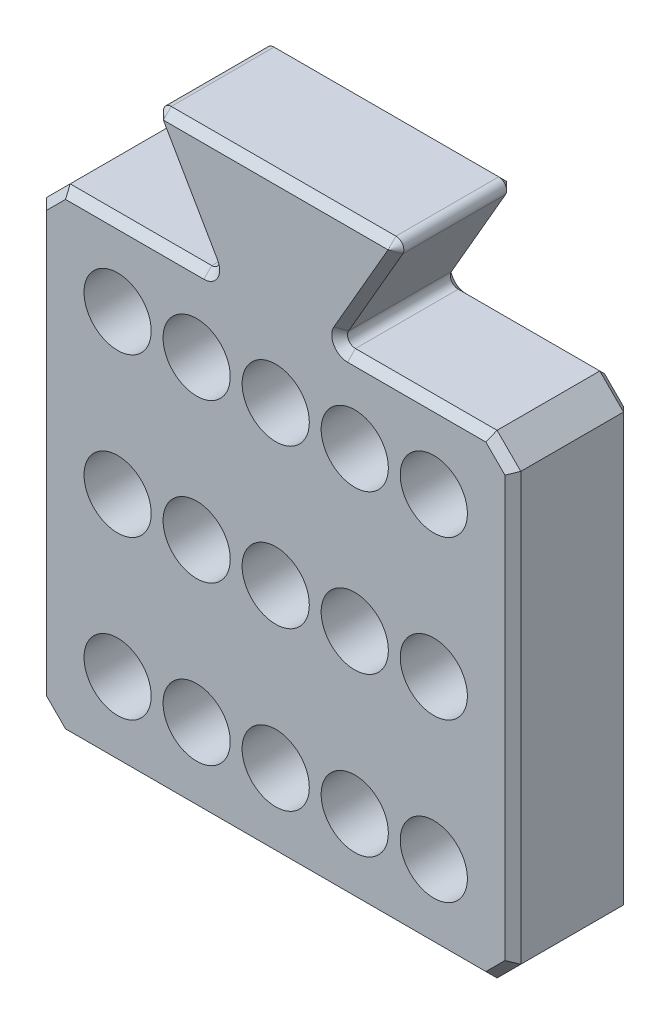
from build123d import *

# Parameters (mm, degrees)
SKETCH2_W                  = 60
SKETCH2_H                  = 60
BOSS_EXTRUDE1_DEPTH        = 7.5
BOSS_EXTRUDE2_DEPTH        = 15
FILLET1_R                  = 1
SKETCH4_R                  = 2.5
CUT_EXTRUDE1_DEPTH         = 57.024687639
CUT_EXTRUDE2_START         = -7.5
SKETCH5_R                  = 4.25
CUT_EXTRUDE2_DEPTH         = 7.5
CHAMFER3_SIZE              = 1
LPATTERN1_COUNT            = 5
LPATTERN1_PITCH            = 10
CHAMFER3_OF_LPATTERN1_SIZE = 1
CHAMFER1_SIZE              = 3
CHAMFER2_SIZE              = 1


# Read off the part's stored shape, not the designer's step: LPattern2
with BuildPart() as part:
    # Sketch2 → Boss-Extrude1 (new, symmetric)
    with BuildSketch(Plane(origin=(0, 0, 0), x_dir=(0, 1, 0), z_dir=(0, 0, 1))):
        Rectangle(SKETCH2_W, SKETCH2_H)
    extrude(amount=BOSS_EXTRUDE1_DEPTH, both=True)

    # Sketch3 → Boss-Extrude2 (add, through all)
    with BuildSketch(Plane.XY.offset(7.5)):
        Polygon((-15.943747687, 44.875), (-7.355662433, 30), (7.355662433, 30), (15.943747687, 44.875), align=None)
    extrude(amount=-BOSS_EXTRUDE2_DEPTH)

    # Fillet1
    fillet1_edges = [part.edges().sort_by_distance(p)[0] for p in [
        (-7.355662433, 30, 0),
        (-15.943747687, 44.875, 0),
        (15.943747687, 44.875, 0),
        (7.355662433, 30, 0),
    ]]
    fillet(fillet1_edges, radius=FILLET1_R)

    # Sketch4 → Cut-Extrude1 (cut, symmetric)
    with BuildSketch(Plane.XY.offset(7.5)):
        with Locations((20, -20)):
            Circle(SKETCH4_R)
    cut_extrude1 = extrude(amount=CUT_EXTRUDE1_DEPTH, both=True, mode=Mode.SUBTRACT)

    # Sketch5 → Cut-Extrude2 (cut)
    with BuildSketch(Plane.XY.offset(7.5).offset(CUT_EXTRUDE2_START)):
        with Locations((20, -20)):
            Circle(SKETCH5_R)
    cut_extrude2 = extrude(amount=CUT_EXTRUDE2_DEPTH, mode=Mode.SUBTRACT)

    # Chamfer3
    chamfer3_edges = [part.edges().sort_by_distance(p)[0] for p in [
        (15.75, -20, 0),
    ]]
    chamfer(chamfer3_edges, length=CHAMFER3_SIZE)

    # LPattern1: Cut-Extrude1, Cut-Extrude2 ×5
    with Locations(*[(-i * LPATTERN1_PITCH, 0, 0) for i in range(1, LPATTERN1_COUNT)]):
        add(cut_extrude1, mode=Mode.SUBTRACT)
        add(cut_extrude2, mode=Mode.SUBTRACT)

    # Chamfer3 of LPattern1
    chamfer3_of_lpattern1_edges = [part.edges().sort_by_distance(p)[0] for p in [
        (5.75, -20, 0),
        (-4.25, -20, 0),
        (-14.25, -20, 0),
        (-24.25, -20, 0),
    ]]
    chamfer(chamfer3_of_lpattern1_edges, length=CHAMFER3_OF_LPATTERN1_SIZE)

    # LPattern2 outline → LPattern2 (revolve, cut)
    with BuildSketch(Plane(origin=(-20, 20, 0), x_dir=(1, 0, 0), z_dir=(0, -1, 0))):
        Polygon((0, -7.5), (2.5, -7.5), (2.5, 0), (3.25, 0), (4.25, 1), (4.25, 7.5), (0, 7.5), align=None)
    revolve(axis=Axis((-20, 20, 0), (0, 0, 1)), mode=Mode.SUBTRACT)

    # LPattern2 2 outline → LPattern2 2 (revolve, cut)
    with BuildSketch(Plane(origin=(-10, 20, 0), x_dir=(1, 0, 0), z_dir=(0, -1, 0))):
        Polygon((0, -7.5), (2.5, -7.5), (2.5, 0), (3.25, 0), (4.25, 1), (4.25, 7.5), (0, 7.5), align=None)
    revolve(axis=Axis((-10, 20, 0), (0, 0, 1)), mode=Mode.SUBTRACT)

    # LPattern2 3 outline → LPattern2 3 (revolve, cut)
    with BuildSketch(Plane.XZ.offset(-20)):
        Polygon((0, -7.5), (2.5, -7.5), (2.5, 0), (3.25, 0), (4.25, 1), (4.25, 7.5), (0, 7.5), align=None)
    revolve(axis=Axis((0, 20, 0), (0, 0, 1)), mode=Mode.SUBTRACT)

    # LPattern2 4 outline → LPattern2 4 (revolve, cut)
    with BuildSketch(Plane(origin=(10, 20, 0), x_dir=(1, 0, 0), z_dir=(0, -1, 0))):
        Polygon((0, -7.5), (2.5, -7.5), (2.5, 0), (3.25, 0), (4.25, 1), (4.25, 7.5), (0, 7.5), align=None)
    revolve(axis=Axis((10, 20, 0), (0, 0, 1)), mode=Mode.SUBTRACT)

    # LPattern2 5 outline → LPattern2 5 (revolve, cut)
    with BuildSketch(Plane(origin=(20, 20, 0), x_dir=(1, 0, 0), z_dir=(0, -1, 0))):
        Polygon((0, -7.5), (2.5, -7.5), (2.5, 0), (3.25, 0), (4.25, 1), (4.25, 7.5), (0, 7.5), align=None)
    revolve(axis=Axis((20, 20, 0), (0, 0, 1)), mode=Mode.SUBTRACT)

    # LPattern2 6 outline → LPattern2 6 (revolve, cut)
    with BuildSketch(Plane(origin=(-20, 0, 0), x_dir=(1, 0, 0), z_dir=(0, -1, 0))):
        Polygon((0, -7.5), (2.5, -7.5), (2.5, 0), (3.25, 0), (4.25, 1), (4.25, 7.5), (0, 7.5), align=None)
    revolve(axis=Axis((-20, 0, 0), (0, 0, 1)), mode=Mode.SUBTRACT)

    # LPattern2 7 outline → LPattern2 7 (revolve, cut)
    with BuildSketch(Plane(origin=(-10, 0, 0), x_dir=(1, 0, 0), z_dir=(0, -1, 0))):
        Polygon((0, -7.5), (2.5, -7.5), (2.5, 0), (3.25, 0), (4.25, 1), (4.25, 7.5), (0, 7.5), align=None)
    revolve(axis=Axis((-10, 0, 0), (0, 0, 1)), mode=Mode.SUBTRACT)

    # LPattern2 8 outline → LPattern2 8 (revolve, cut)
    with BuildSketch(Plane.XZ):
        Polygon((0, -7.5), (2.5, -7.5), (2.5, 0), (3.25, 0), (4.25, 1), (4.25, 7.5), (0, 7.5), align=None)
    revolve(axis=Axis((0, 0, 0), (0, 0, 1)), mode=Mode.SUBTRACT)

    # LPattern2 9 outline → LPattern2 9 (revolve, cut)
    with BuildSketch(Plane(origin=(10, 0, 0), x_dir=(1, 0, 0), z_dir=(0, -1, 0))):
        Polygon((0, -7.5), (2.5, -7.5), (2.5, 0), (3.25, 0), (4.25, 1), (4.25, 7.5), (0, 7.5), align=None)
    revolve(axis=Axis((10, 0, 0), (0, 0, 1)), mode=Mode.SUBTRACT)

    # LPattern2 10 outline → LPattern2 10 (revolve, cut)
    with BuildSketch(Plane(origin=(20, 0, 0), x_dir=(1, 0, 0), z_dir=(0, -1, 0))):
        Polygon((0, -7.5), (2.5, -7.5), (2.5, 0), (3.25, 0), (4.25, 1), (4.25, 7.5), (0, 7.5), align=None)
    revolve(axis=Axis((20, 0, 0), (0, 0, 1)), mode=Mode.SUBTRACT)

    # Chamfer1
    chamfer1_edges = [part.edges().sort_by_distance(p)[0] for p in [
        (-30, -30, 0),
        (-30, 30, 0),
        (30, 30, 0),
        (30, -30, 0),
    ]]
    chamfer(chamfer1_edges, length=CHAMFER1_SIZE)

    # Chamfer2
    chamfer2_edges = [part.edges().sort_by_distance(p)[0] for p in [
        (11.64970506, 37.4375, 7.5),
        (-30, 0, -7.5),
        (-30, 0, 7.5),
        (11.64970506, 37.4375, -7.5),
        (30, 0, -7.5),
        (0, -30, -7.5),
        (-18.04385662, 30, -7.5),
        (28.5, 28.5, -7.5),
        (28.5, -28.5, -7.5),
        (-28.5, -28.5, -7.5),
        (-28.5, 28.5, -7.5),
        (-18.04385662, 30, 7.5),
        (0, -30, 7.5),
        (30, 0, 7.5),
        (28.5, 28.5, 7.5),
        (28.5, -28.5, 7.5),
        (-28.5, -28.5, 7.5),
        (-28.5, 28.5, 7.5),
        (18.04385662, 30, 7.5),
        (0, 44.875, 7.5),
        (-11.64970506, 37.4375, 7.5),
        (-15.077722283, 44.375, 7.5),
        (15.077722283, 44.375, 7.5),
        (0, 44.875, -7.5),
        (-11.64970506, 37.4375, -7.5),
        (18.04385662, 30, -7.5),
        (-15.077722283, 44.375, -7.5),
        (15.077722283, 44.375, -7.5),
        (-8.221687836, 30.5, 7.5),
        (-8.221687836, 30.5, -7.5),
        (8.221687836, 30.5, 7.5),
        (8.221687836, 30.5, -7.5),
    ]]
    chamfer(chamfer2_edges, length=CHAMFER2_SIZE - 0.0001)  # a hair under: the kernel refuses the full size


solid = part.part
